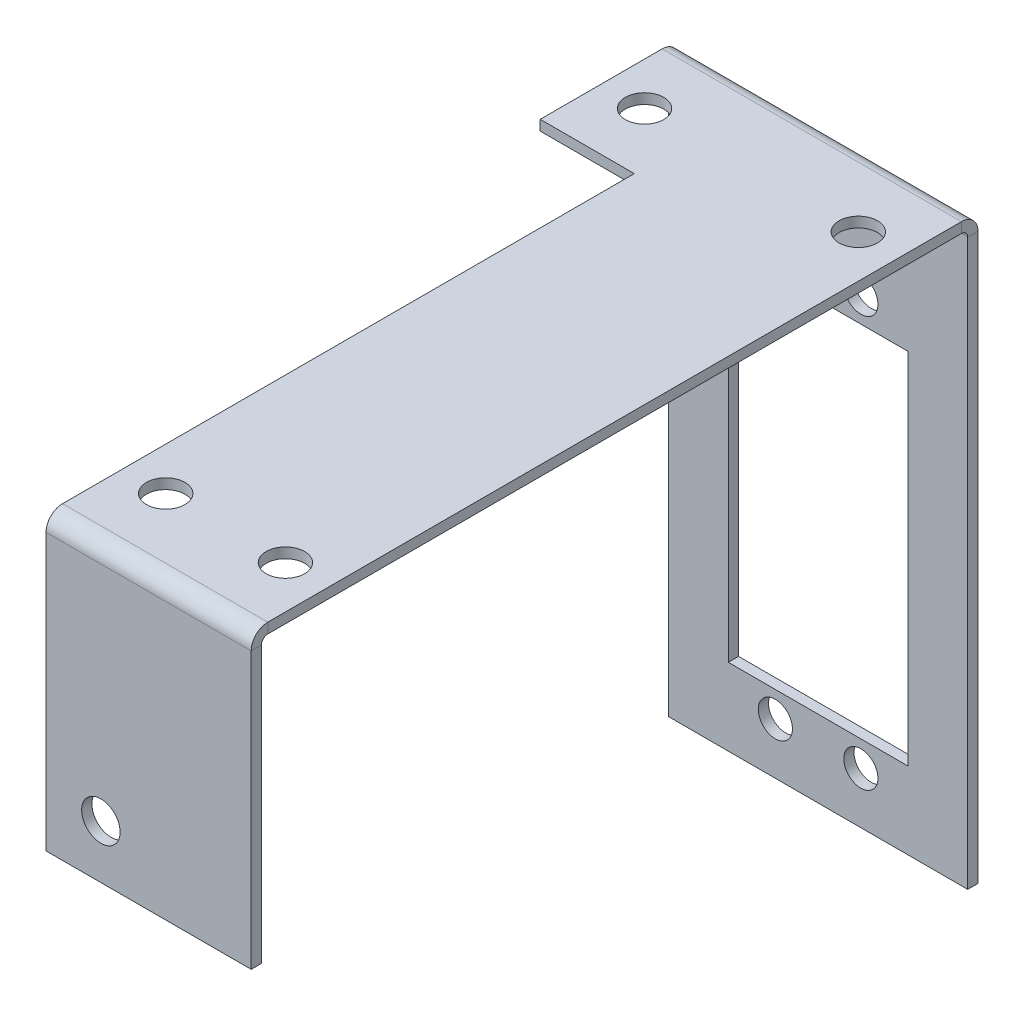
from build123d import *

# Parameters (mm, degrees)
SKETCH_1_W                       = 35
SKETCH_1_H                       = 68
SKETCH_1_R                       = 2
SKETCH_1_W_2                     = 21
SKETCH_1_H_2                     = 42
SM_BASE_FLANGE_1_DEPTH           = 1.2
SM_EDGE_FLANGE_1_STRIP_W         = 6.2732
SM_EDGE_FLANGE_1_STRIP_H         = 1.2
SM_EDGE_FLANGE_1_STRIP_CUT_DEPTH = 35
SM_EDGE_FLANGE_1_DEPTH           = 35
SM_EDGE_FLANGE_1_FLAT_DEPTH      = 1.2
SM_EDGE_FLANGE_2_STRIP_W         = 6.2732
SM_EDGE_FLANGE_2_STRIP_H         = 1.2
SM_EDGE_FLANGE_2_STRIP_CUT_DEPTH = 24
SM_EDGE_FLANGE_2_DEPTH           = 24
CUT_EXTRUDE_1_REACH              = 109.191
SKETCH_12_R                      = 2.25
CUT_EXTRUDE_2_REACH              = 113.492
SKETCH_13_R                      = 2.25


# Sheet-metal steps are written as plain solids
with BuildPart() as part:
    # Sketch 1 → Базовая кромка1 (new body)
    with BuildSketch(Plane.XY):
        with Locations((10.5, 25)):
            Rectangle(SKETCH_1_W, SKETCH_1_H)
        with Locations((5.5, 45)):
            Circle(SKETCH_1_R, mode=Mode.SUBTRACT)
        with Locations((15.5, 45)):
            Circle(SKETCH_1_R, mode=Mode.SUBTRACT)
        with Locations((5.5, -3)):
            Circle(SKETCH_1_R, mode=Mode.SUBTRACT)
        with Locations((15.5, -3)):
            Circle(SKETCH_1_R, mode=Mode.SUBTRACT)
        with Locations((10.5, 21)):
            Rectangle(SKETCH_1_W_2, SKETCH_1_H_2, mode=Mode.SUBTRACT)
    extrude(amount=-SM_BASE_FLANGE_1_DEPTH)

    # Ребро-кромка1 strip (across the edge) → Ребро-кромка1 strip cut (cut)
    with BuildSketch(Plane(origin=(28, 59, 0), x_dir=(0, -1, 0), z_dir=(-1, 0, 0))):
        with Locations((-1.2, -0.6)):
            Rectangle(SM_EDGE_FLANGE_1_STRIP_W, SM_EDGE_FLANGE_1_STRIP_H)
    extrude(amount=SM_EDGE_FLANGE_1_STRIP_CUT_DEPTH, mode=Mode.SUBTRACT)

    # Ребро-кромка1 bend section (across the edge) → Ребро-кромка1 (add)
    with BuildSketch(Plane(origin=(28, 59, 0), x_dir=(0, -1, 0), z_dir=(-1, 0, 0))):
        with BuildLine():
            Line((0, 0.7366), (1.2, 0.7366))
            ThreePointArc((1.2, 0.7366), (1.415745145, 0.215745145), (1.9366, 0))
            Line((1.9366, 0), (1.9366, -1.2))
            ThreePointArc((1.9366, -1.2), (0.567217008, -0.632782992), (0, 0.7366))
        make_face()
    extrude(amount=SM_EDGE_FLANGE_1_DEPTH)

    # Ребро-кромка1 profile (on flange) → Ребро-кромка1 flat (add)
    with BuildSketch(Plane(origin=(0, 59, 0), x_dir=(-1, 0, 0), z_dir=(0, 1, 0))):
        Polygon((-28, 83.8), (-28, 0.7366), (7, 0.7366), (7, 15), (-4, 15), (-4, 83.8), align=None)
    extrude(amount=-SM_EDGE_FLANGE_1_FLAT_DEPTH)

    # Ребро-кромка2 strip (across the edge) → Ребро-кромка2 strip cut (cut)
    with BuildSketch(Plane(origin=(28, 57.8, 83.8), x_dir=(0, 0, -1), z_dir=(-1, 0, 0))):
        with Locations((-1.2, -0.6)):
            Rectangle(SM_EDGE_FLANGE_2_STRIP_W, SM_EDGE_FLANGE_2_STRIP_H)
    extrude(amount=SM_EDGE_FLANGE_2_STRIP_CUT_DEPTH, mode=Mode.SUBTRACT)

    # Ребро-кромка2 section (across the edge) → Ребро-кромка2 (add)
    with BuildSketch(Plane(origin=(28, 57.8, 83.8), x_dir=(0, 0, -1), z_dir=(-1, 0, 0))):
        with BuildLine():
            Line((0, 0.7366), (0, 33))
            Line((0, 33), (1.2, 33))
            Line((1.2, 33), (1.2, 0.7366))
            ThreePointArc((1.2, 0.7366), (1.415745145, 0.215745145), (1.9366, 0))
            Line((1.9366, 0), (1.9366, -1.2))
            ThreePointArc((1.9366, -1.2), (0.567217008, -0.632782992), (0, 0.7366))
        make_face()
    extrude(amount=SM_EDGE_FLANGE_2_DEPTH)

    # Эскиз12 → Вырез-Вытянуть1 (cut, up to next)
    with BuildSketch(Plane.XY.offset(83.8), mode=Mode.PRIVATE) as cut_extrude_1_sk1:
        with Locations((10.419999997, 31.03)):
            Circle(SKETCH_12_R)
    cut_extrude_1_tool1 = extrude(cut_extrude_1_sk1.sketch, amount=-CUT_EXTRUDE_1_REACH, mode=Mode.PRIVATE) & part.part
    add(cut_extrude_1_tool1.solids().sort_by_distance((10.42, 31.03, 83.8))[0], mode=Mode.SUBTRACT)

    # Эскиз13 → Вырез-Вытянуть2 (cut, up to next)
    with BuildSketch(Plane(origin=(0, 59, 0), x_dir=(1, 0, 0), z_dir=(0, 1, 0)), mode=Mode.PRIVATE) as cut_extrude_2_sk1:
        with Locations(Location((23, -7.8, 0), (0, 0, 270))):
            Circle(SKETCH_13_R)
    cut_extrude_2_tool1 = extrude(cut_extrude_2_sk1.sketch, amount=-CUT_EXTRUDE_2_REACH, mode=Mode.PRIVATE) & part.part
    # Эскиз13 → Вырез-Вытянуть2 (cut, up to next)
    with BuildSketch(Plane(origin=(0, 59, 0), x_dir=(1, 0, 0), z_dir=(0, 1, 0)), mode=Mode.PRIVATE) as cut_extrude_2_sk2:
        with Locations(Location((-2, -7.8, 0), (0, 0, 270))):
            Circle(SKETCH_13_R)
    cut_extrude_2_tool2 = extrude(cut_extrude_2_sk2.sketch, amount=-CUT_EXTRUDE_2_REACH, mode=Mode.PRIVATE) & part.part
    # Эскиз13 → Вырез-Вытянуть2 (cut, up to next)
    with BuildSketch(Plane(origin=(0, 59, 0), x_dir=(1, 0, 0), z_dir=(0, 1, 0)), mode=Mode.PRIVATE) as cut_extrude_2_sk3:
        with Locations(Location((9, -74.8, 0), (0, 0, 270))):
            Circle(SKETCH_13_R)
    cut_extrude_2_tool3 = extrude(cut_extrude_2_sk3.sketch, amount=-CUT_EXTRUDE_2_REACH, mode=Mode.PRIVATE) & part.part
    # Эскиз13 → Вырез-Вытянуть2 (cut, up to next)
    with BuildSketch(Plane(origin=(0, 59, 0), x_dir=(1, 0, 0), z_dir=(0, 1, 0)), mode=Mode.PRIVATE) as cut_extrude_2_sk4:
        with Locations(Location((23, -74.8, 0), (0, 0, 270))):
            Circle(SKETCH_13_R)
    cut_extrude_2_tool4 = extrude(cut_extrude_2_sk4.sketch, amount=-CUT_EXTRUDE_2_REACH, mode=Mode.PRIVATE) & part.part
    add(cut_extrude_2_tool1.solids().sort_by_distance((23, 59, 7.8))[0], mode=Mode.SUBTRACT)
    add(cut_extrude_2_tool2.solids().sort_by_distance((-2, 59, 7.8))[0], mode=Mode.SUBTRACT)
    add(cut_extrude_2_tool3.solids().sort_by_distance((9, 59, 74.8))[0], mode=Mode.SUBTRACT)
    add(cut_extrude_2_tool4.solids().sort_by_distance((23, 59, 74.8))[0], mode=Mode.SUBTRACT)


solid = part.part
